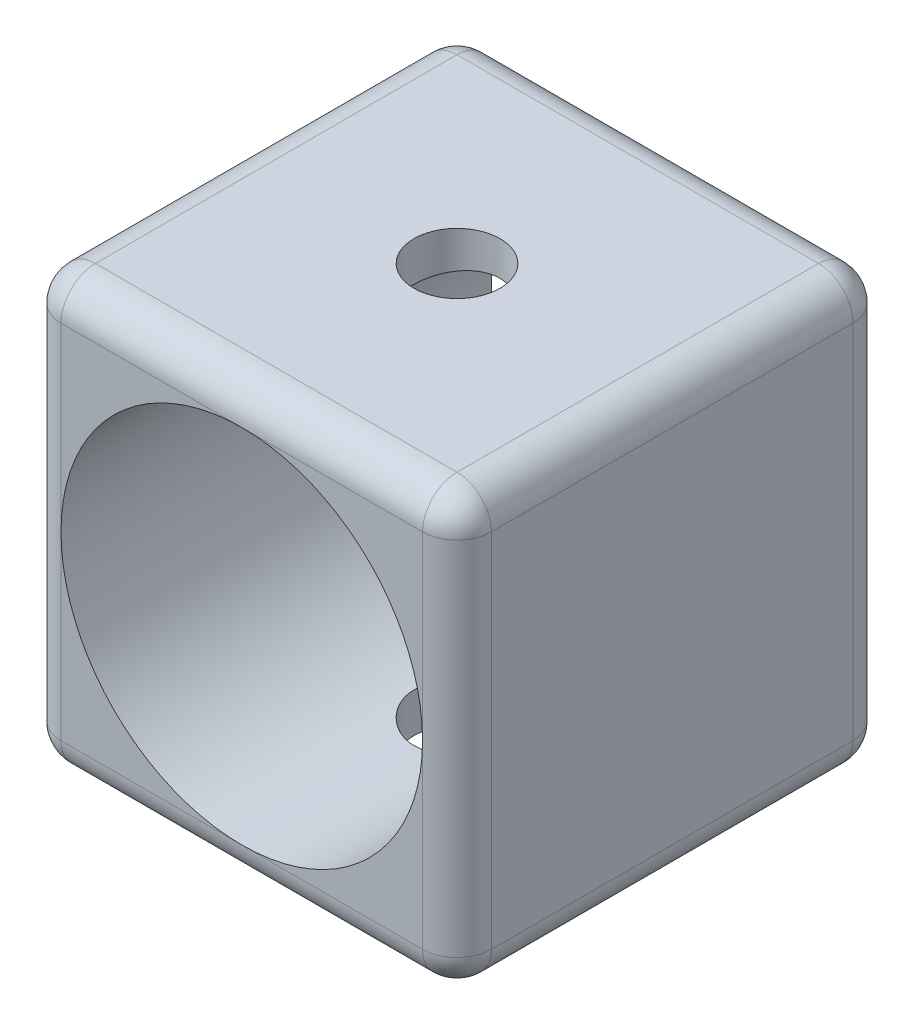
from build123d import *

# Parameters (mm, degrees)
SKETCH1_W           = 25
SKETCH1_H           = 25
BOSS_EXTRUDE1_DEPTH = 25
SKETCH2_R           = 10.5
CUT_EXTRUDE1_DEPTH  = 25
CUT_EXTRUDE2_REACH  = 32.619
SKETCH3_R           = 2.5
FILLET1_R           = 2


with BuildPart() as part:
    # Sketch1 → Boss-Extrude1 (new body)
    with BuildSketch(Plane(origin=(0, 0, 0), x_dir=(1, 0, 0), z_dir=(0, 1, 0))):
        Rectangle(SKETCH1_W, SKETCH1_H)
    extrude(amount=BOSS_EXTRUDE1_DEPTH)

    # Sketch2 → Cut-Extrude1 (cut)
    with BuildSketch(Plane.XY.offset(12.5)):
        with Locations((0, 12.5)):
            Circle(SKETCH2_R)
    extrude(amount=-CUT_EXTRUDE1_DEPTH, mode=Mode.SUBTRACT)

    # Cut-Extrude2: up to this face of the body (flat: up to its plane)
    cut_extrude2_end = Plane(part.part.faces().sort_by_distance((0, 0, 0))[0])
    # Sketch3 → Cut-Extrude2 (cut, up to the picked face)
    with BuildSketch(Plane(origin=(0, 25, 0), x_dir=(1, 0, 0), z_dir=(0, 1, 0)), mode=Mode.PRIVATE) as cut_extrude2_sk1:
        with Locations(Location((0, 0, 0), (0, 0, 270))):
            Circle(SKETCH3_R)
    cut_extrude2_tool1 = split(extrude(cut_extrude2_sk1.sketch, amount=-CUT_EXTRUDE2_REACH, mode=Mode.PRIVATE), bisect_by=cut_extrude2_end, keep=Keep.BOTH, mode=Mode.PRIVATE)
    add(cut_extrude2_tool1.solids().sort_by(Axis((0, 25, 0), (0, -1, 0)))[0], mode=Mode.SUBTRACT)

    # Fillet1
    fillet1_edges = [part.edges().sort_by_distance(p)[0] for p in [
        (12.5, 25, 0),
        (0, 25, -12.5),
        (-12.5, 25, 0),
        (0, 0, -12.5),
        (12.5, 0, 0),
        (0, 0, 12.5),
        (-12.5, 0, 0),
        (-12.5, 12.5, -12.5),
        (12.5, 12.5, -12.5),
        (12.5, 12.5, 12.5),
        (-12.5, 12.5, 12.5),
        (0, 25, 12.5),
    ]]
    fillet(fillet1_edges, radius=FILLET1_R - 0.0001)  # a hair under: the kernel refuses the full size


solid = part.part
